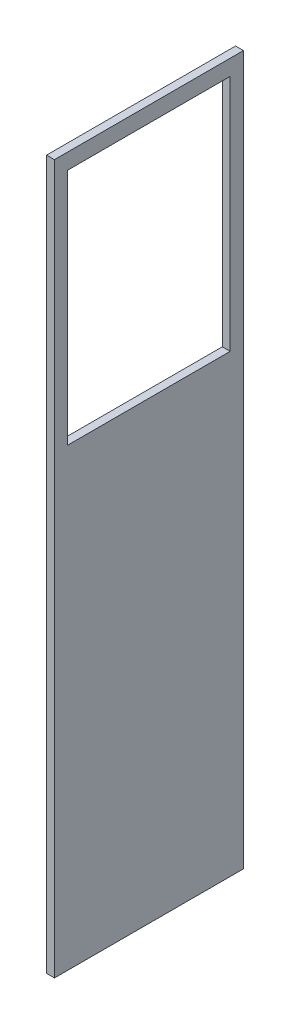
from build123d import *

# Parameters (mm, degrees)
SKETCH1_W           = 76.2
SKETCH1_H           = 285.75
BOSS_EXTRUDE1_DEPTH = 3.175
CUT_EXTRUDE1_REACH  = 297.753
SKETCH2_W           = 65.532
SKETCH2_H           = 96.012


with BuildPart() as part:
    # Sketch1 → Boss-Extrude1 (new body)
    with BuildSketch(Plane(origin=(0, 0, 0), x_dir=(0, 0, -1), z_dir=(1, 0, 0))):
        with Locations((38.1, 142.875)):
            Rectangle(SKETCH1_W, SKETCH1_H)
    extrude(amount=BOSS_EXTRUDE1_DEPTH)

    # Sketch2 → Cut-Extrude1 (cut, up to next)
    with BuildSketch(Plane.ZY, mode=Mode.PRIVATE) as cut_extrude1_sk1:
        with Locations((-38.1, 231.394)):
            Rectangle(SKETCH2_W, SKETCH2_H)
    cut_extrude1_tool1 = extrude(cut_extrude1_sk1.sketch, amount=-CUT_EXTRUDE1_REACH, mode=Mode.PRIVATE) & part.part
    add(cut_extrude1_tool1.solids().sort_by_distance((0, 231.394, -38.1))[0], mode=Mode.SUBTRACT)


solid = part.part
